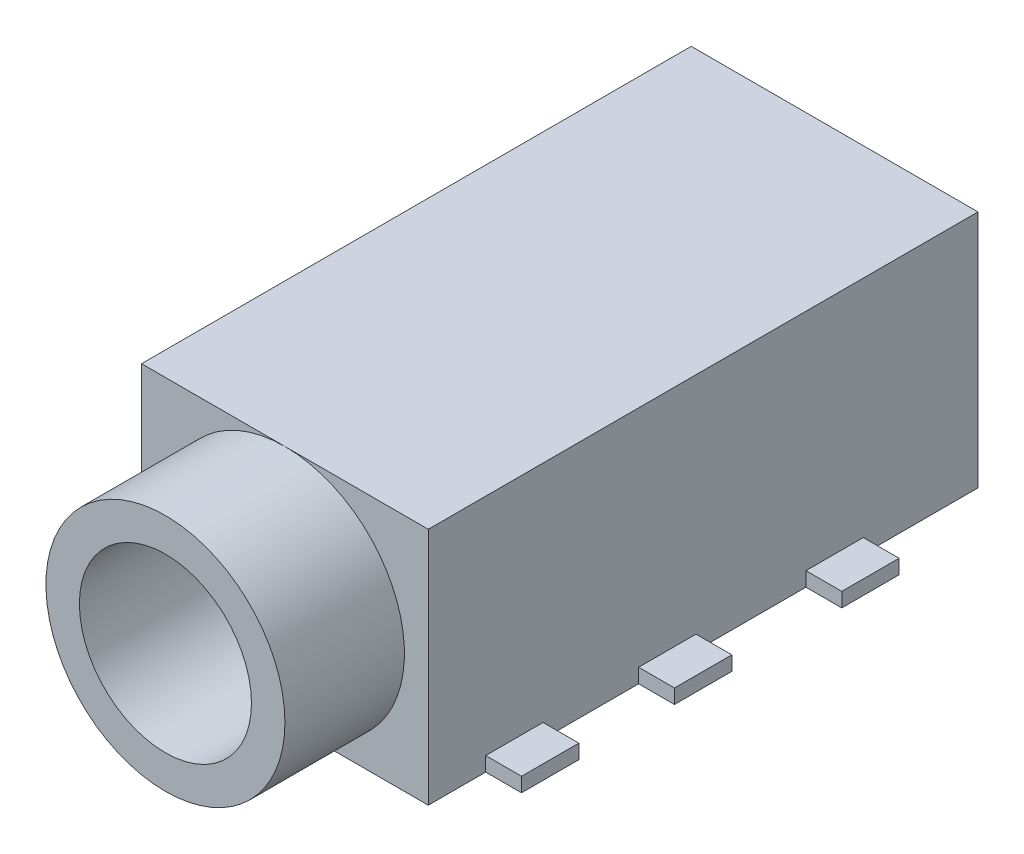
from build123d import *

# Parameters (mm, degrees)
SKETCH1_W           = 6
SKETCH1_H           = 5
BOSS_EXTRUDE1_DEPTH = 11.5
SKETCH2_R           = 2.5
SKETCH2_R_2         = 1.8
BOSS_EXTRUDE2_DEPTH = 2.5
CUT_EXTRUDE1_START  = -10
SKETCH3_R           = 1.8
CUT_EXTRUDE1_DEPTH  = 10
SKETCH4_W           = 0.75
SKETCH4_H           = 1.2
BOSS_EXTRUDE3_DEPTH = 0.3
SKETCH5_R           = 0.75
BOSS_EXTRUDE4_DEPTH = 0.6


with BuildPart() as part:
    # Sketch1 → Boss-Extrude1 (new body)
    with BuildSketch(Plane.XY):
        Rectangle(SKETCH1_W, SKETCH1_H)
    extrude(amount=BOSS_EXTRUDE1_DEPTH)

    # Sketch2 → Boss-Extrude2 (add)
    with BuildSketch(Plane.XY.offset(11.5)):
        Circle(SKETCH2_R)
        Circle(SKETCH2_R_2, mode=Mode.SUBTRACT)
    extrude(amount=BOSS_EXTRUDE2_DEPTH)

    # Sketch3 → Cut-Extrude1 (cut)
    with BuildSketch(Plane.XY.offset(11.5).offset(CUT_EXTRUDE1_START)):
        Circle(SKETCH3_R)
    extrude(amount=CUT_EXTRUDE1_DEPTH, mode=Mode.SUBTRACT)

    # Sketch4 → Boss-Extrude3 (add)
    with BuildSketch(Plane.XZ.offset(2.5)):
        with Locations((3.375, 9.7)):
            Rectangle(SKETCH4_W, SKETCH4_H)
        with Locations((3.375, 6.5)):
            Rectangle(SKETCH4_W, SKETCH4_H)
        with Locations((3.375, 3)):
            Rectangle(SKETCH4_W, SKETCH4_H)
        with Locations((-3.375, 3)):
            Rectangle(SKETCH4_W, SKETCH4_H)
        with Locations((-3.375, 6.5)):
            Rectangle(SKETCH4_W, SKETCH4_H)
        with Locations((-3.375, 9.7)):
            Rectangle(SKETCH4_W, SKETCH4_H)
    extrude(amount=-BOSS_EXTRUDE3_DEPTH)

    # Sketch5 → Boss-Extrude4 (add)
    with BuildSketch(Plane.XZ.offset(2.5)):
        with Locations((0, 9)):
            Circle(SKETCH5_R)
        with Locations((0, 3)):
            Circle(SKETCH5_R)
    extrude(amount=BOSS_EXTRUDE4_DEPTH)


solid = part.part
